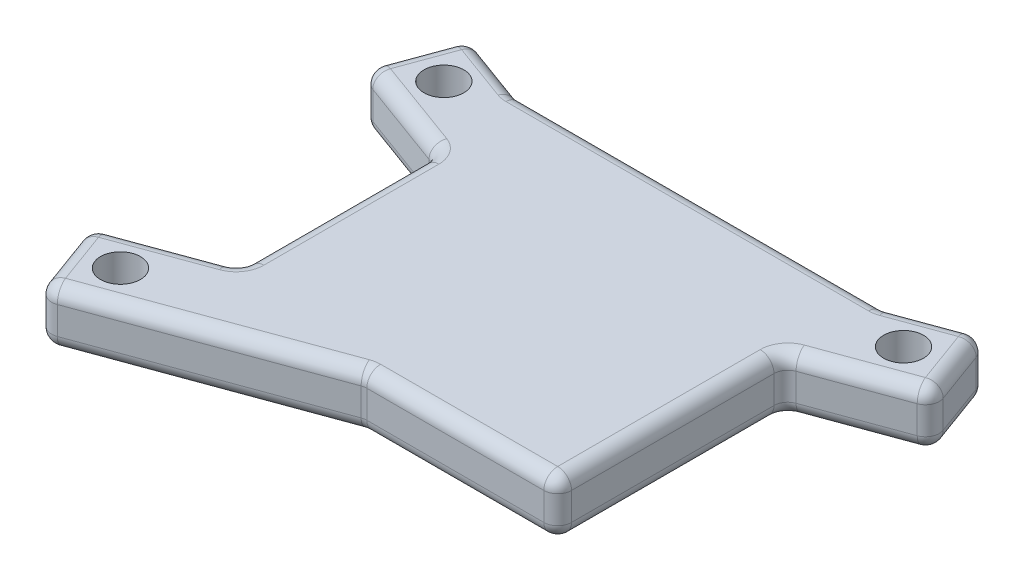
from build123d import *

# Parameters (mm, degrees)
BOSS_EXTRUDE1_DEPTH = 6.35
SKETCH2_R           = 2.286
CUT_EXTRUDE1_DEPTH  = 110.879381153
FILLET1_R           = 1.5875
SKETCH3_R           = 2.286
CUT_EXTRUDE2_DEPTH  = 3.175


with BuildPart() as part:
    # Sketch1 → Boss-Extrude1 (new body)
    with BuildSketch(Plane(origin=(0, 0, 0), x_dir=(1, 0, 0), z_dir=(0, 1, 0))):
        Polygon((21.229343583, -21.824581583), (29.589604098, -24.883856724), (71.727640942, -24.883856724), (80.087901457, -21.824581583), (83.36112252, -30.769504661), (70.66112252, -35.416823273), (70.66112252, -61.327405263), (48.489495365, -61.327405263), (21.229343583, -71.302728943), (17.95612252, -62.357805865), (30.65612252, -57.710487253), (30.65612252, -35.416823273), (17.95612252, -30.769504661), align=None)
    extrude(amount=BOSS_EXTRUDE1_DEPTH)

    # Sketch2 → Cut-Extrude1 (cut, through all)
    with BuildSketch(Plane(origin=(0, 6.35, 0), x_dir=(1, 0, 0), z_dir=(0, 1, 0))):
        with Locations((77.01112252, -28.021816555)):
            Circle(SKETCH2_R)
        with Locations((24.30612252, -65.105493971)):
            Circle(SKETCH2_R)
        with Locations((24.30612252, -28.021816555)):
            Circle(SKETCH2_R)
    extrude(amount=-CUT_EXTRUDE1_DEPTH, mode=Mode.SUBTRACT)

    # Fillet1
    fillet1_edges = [part.edges().sort_by_distance(p)[0] for p in [
        (77.01112252, 6.35, 33.093163967),
        (77.01112252, 0, 33.093163967),
        (24.30612252, 6.35, 33.093163967),
        (24.30612252, 0, 33.093163967),
        (24.30612252, 6.35, 60.034146559),
        (24.30612252, 0, 60.034146559),
        (75.907771199, 6.35, 23.354219153),
        (75.907771199, 0, 23.354219153),
        (25.40947384, 0, 23.354219153),
        (59.575308942, 6.35, 61.327405263),
        (59.575308942, 0, 61.327405263),
        (70.66112252, 3.175, 61.327405263),
        (70.66112252, 6.35, 48.372114268),
        (70.66112252, 3.175, 35.416823273),
        (70.66112252, 0, 48.372114268),
        (21.229343583, 3.175, 21.824581583),
        (19.592733051, 6.35, 26.297043122),
        (17.95612252, 3.175, 30.769504661),
        (19.592733051, 0, 26.297043122),
        (17.95612252, 3.175, 62.357805865),
        (19.592733051, 6.35, 66.830267404),
        (19.592733051, 0, 66.830267404),
        (30.65612252, 3.175, 35.416823273),
        (30.65612252, 6.35, 46.563655263),
        (30.65612252, 3.175, 57.710487253),
        (30.65612252, 0, 46.563655263),
        (71.727640942, 3.175, 24.883856724),
        (50.65862252, 6.35, 24.883856724),
        (29.589604098, 3.175, 24.883856724),
        (50.65862252, 0, 24.883856724),
        (83.36112252, 3.175, 30.769504661),
        (81.724511988, 6.35, 26.297043122),
        (80.087901457, 3.175, 21.824581583),
        (81.724511988, 0, 26.297043122),
        (21.229343583, 3.175, 71.302728943),
        (34.859419474, 6.35, 66.315067103),
        (48.489495365, 3.175, 61.327405263),
        (34.859419474, 0, 66.315067103),
        (25.40947384, 6.35, 23.354219153),
    ]]
    fillet(fillet1_edges, radius=FILLET1_R)

    # Sketch3 → Cut-Extrude2 (cut)
    with BuildSketch(Plane.XZ):
        with Locations((50.65862252, 40.758856724)):
            Circle(SKETCH3_R)
    extrude(amount=-CUT_EXTRUDE2_DEPTH, mode=Mode.SUBTRACT)


solid = part.part
